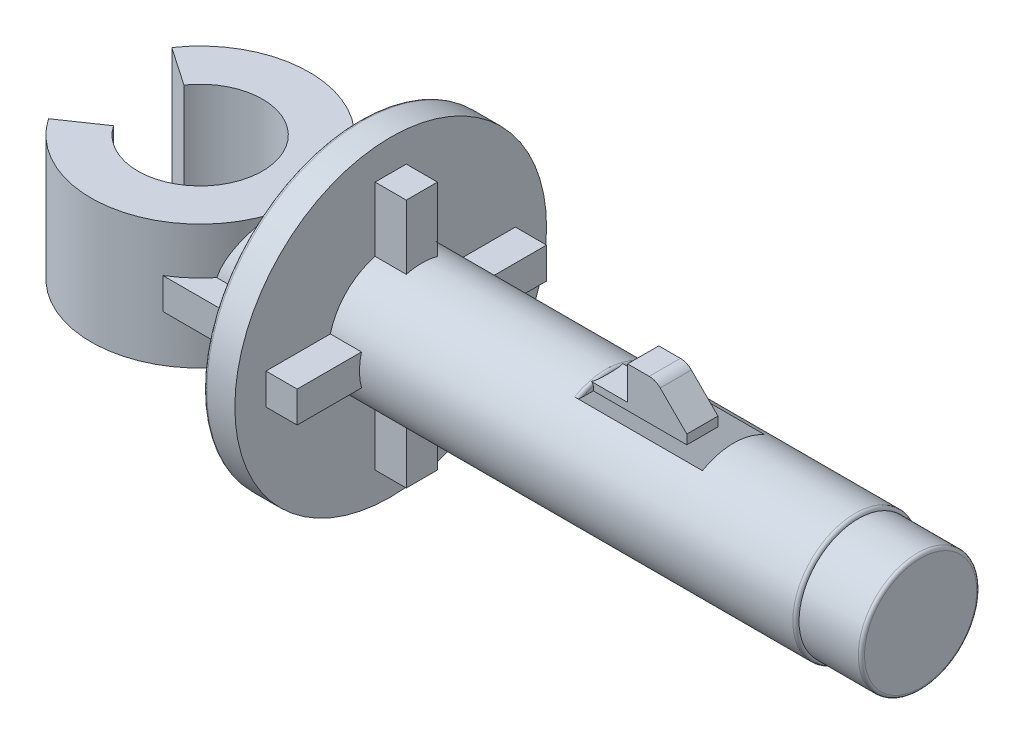
from build123d import *

# Parameters (mm, degrees)
SCHIZZO1_R                    = 2
ESTRUSIONE_ESTRUSIONE1_DEPTH  = 17
SCHIZZO2_OUTSIDE_W            = 9.584
SCHIZZO2_OUTSIDE_H            = 9.584
SCHIZZO2_OUTSIDE_R            = 1.9
TAGLIO_ESTRUSIONE1_DEPTH      = 2
SCHIZZO6_W                    = 15
SCHIZZO6_H                    = 4
TAGLIO_ESTRUSIONE3_DEPTH      = 0.1
TAGLIO_ESTRUSIONE4_DEPTH      = 1.7
TAGLIO_ESTRUSIONE4_DEPTH_BACK = 18.23368794
SCHIZZO5_W                    = 13
SCHIZZO5_H                    = 2
SCHIZZO7_W                    = 4
SCHIZZO7_H                    = 2
TAGLIO_ESTRUSIONE5_DEPTH      = 18.555910686
ESTRUSIONE_ESTRUSIONE2_DEPTH  = 0.5
TAGLIO_ESTRUSIONE6_DEPTH      = 0.07
ESTRUSIONE_ESTRUSIONE4_DEPTH  = 0.5
ESTRUSIONE_ESTRUSIONE5_DEPTH  = 0.5
SCHIZZO20_R                   = 5
ESTRUSIONE_ESTRUSIONE6_DEPTH  = 1
SCHIZZO23_R                   = 2.25
ESTRUSIONE_ESTRUSIONE7_DEPTH  = 3
ESTRUSIONE_ESTRUSIONE10_DEPTH = 2
ESTRUSIONE_ESTRUSIONE8_DEPTH  = 0.5
SCHIZZO35_W                   = 3
SCHIZZO35_H                   = 2.061552812
TAGLIO_ESTRUSIONE7_DEPTH      = 1
RACCORDO22_R                  = 0.5
RACCORDO23_R                  = 0.1
RACCORDO24_R                  = 0.1
RACCORDO25_R                  = 0.1
RACCORDO28_R                  = 0.1


# Some blends are built 0.0001 mm under size
with BuildPart() as part:
    # Schizzo1 → Estrusione-Estrusione1 (new body)
    with BuildSketch(Plane(origin=(0, 0, 0), x_dir=(0, 0, -1), z_dir=(1, 0, 0))):
        Circle(SCHIZZO1_R)
    extrude(amount=-ESTRUSIONE_ESTRUSIONE1_DEPTH)

    # Schizzo2 outside → Taglio-Estrusione1 (cut)
    with BuildSketch(Plane(origin=(0, 0, 0), x_dir=(0, 0, -1), z_dir=(1, 0, 0))):
        Rectangle(SCHIZZO2_OUTSIDE_W, SCHIZZO2_OUTSIDE_H)
        Circle(SCHIZZO2_OUTSIDE_R, mode=Mode.SUBTRACT)
    extrude(amount=-TAGLIO_ESTRUSIONE1_DEPTH, mode=Mode.SUBTRACT)

    # Schizzo6 → Taglio-Estrusione3 (cut)
    with BuildSketch(Plane(origin=(0, -2, 0), x_dir=(-1, 0, 0), z_dir=(0, -1, 0))):
        with Locations((9.5, 0)):
            Rectangle(SCHIZZO6_W, SCHIZZO6_H)
    extrude(amount=-TAGLIO_ESTRUSIONE3_DEPTH, mode=Mode.SUBTRACT)

    # Schizzo5 → Taglio-Estrusione4 (cut, two sides: drawn at the far end of the back side and taken through both)
    with BuildSketch(Plane(origin=(0, 0, 0), x_dir=(1, 0, 0), z_dir=(0, 1, 0)).offset(-TAGLIO_ESTRUSIONE4_DEPTH_BACK)):
        with Locations((-9.5, 0)):
            Rectangle(SCHIZZO5_W, SCHIZZO5_H)
    extrude(amount=TAGLIO_ESTRUSIONE4_DEPTH + TAGLIO_ESTRUSIONE4_DEPTH_BACK, mode=Mode.SUBTRACT)

    # Schizzo7 → Taglio-Estrusione5 (cut, through all)
    with BuildSketch(Plane(origin=(0, 2, 0), x_dir=(1, 0, 0), z_dir=(0, 1, 0))):
        with Locations((-8, 0)):
            Rectangle(SCHIZZO7_W, SCHIZZO7_H)
    extrude(amount=-TAGLIO_ESTRUSIONE5_DEPTH, mode=Mode.SUBTRACT)

    # Schizzo12 → Estrusione-Estrusione2 (add, symmetric)
    with BuildSketch(Plane.XY):
        Polygon((-10, 2), (-8.9, 2), (-8.9, 3), (-8, 3), (-7, 2), (-7, 1.7), (-10, 1.7), align=None)
    extrude(amount=ESTRUSIONE_ESTRUSIONE2_DEPTH, both=True)

    # Schizzo16 → Taglio-Estrusione6 (cut)
    with BuildSketch(Plane(origin=(0, 2, 0), x_dir=(1, 0, 0), z_dir=(0, 1, 0))):
        Polygon((-8.9, 0.5), (-10, 0.5), (-10, 0), (-10, -0.5), (-8.9, -0.5), align=None)
    extrude(amount=-TAGLIO_ESTRUSIONE6_DEPTH, mode=Mode.SUBTRACT)

    # Schizzo17 → Estrusione-Estrusione4 (add, symmetric)
    with BuildSketch(Plane.XY):
        Polygon((-17, 4), (-16, 4), (-16, 0.047058824), (-17, 0.05), align=None)
    estrusione_estrusione4 = extrude(amount=ESTRUSIONE_ESTRUSIONE4_DEPTH, both=True)

    # Specchia2: Estrusione-Estrusione4 across plane
    add(estrusione_estrusione4.mirror(Plane.ZX))

    # Schizzo19 → Estrusione-Estrusione5 (add, symmetric)
    with BuildSketch(Plane(origin=(0, 0, 0), x_dir=(1, 0, 0), z_dir=(0, 1, 0))):
        Polygon((-17, 2), (-17, 0), (-16, 0), (-16, 2), (-16, 4), (-17, 4), align=None)
    estrusione_estrusione5 = extrude(amount=ESTRUSIONE_ESTRUSIONE5_DEPTH, both=True)

    # Specchia5: Estrusione-Estrusione5 across plane
    add(estrusione_estrusione5.mirror(Plane.XY))

    # Schizzo20 → Estrusione-Estrusione6 (add)
    with BuildSketch(Plane.ZY.offset(17)):
        Circle(SCHIZZO20_R)
    extrude(amount=ESTRUSIONE_ESTRUSIONE6_DEPTH)

    # Schizzo23 → Estrusione-Estrusione7 (add)
    with BuildSketch(Plane.ZY.offset(18)):
        Circle(SCHIZZO23_R)
    extrude(amount=ESTRUSIONE_ESTRUSIONE7_DEPTH)

    # Schizzo22 → Estrusione-Estrusione10 (add, symmetric)
    with BuildSketch(Plane(origin=(0, 0, 0), x_dir=(1, 0, 0), z_dir=(0, 1, 0))):
        with BuildLine():
            Line((-24.762298216, -1.129872594), (-26, -1.977277039))
            ThreePointArc((-26, -1.977277039), (-19.612029171, 0), (-26, 1.977277039))
            Line((-26, 1.977277039), (-24.762298216, 1.129872594))
            ThreePointArc((-24.762298216, 1.129872594), (-21.112029171, 0), (-24.762298216, -1.129872594))
        make_face()
    extrude(amount=ESTRUSIONE_ESTRUSIONE10_DEPTH, both=True)

    # Schizzo34 → Estrusione-Estrusione8 (add, symmetric)
    with BuildSketch(Plane(origin=(0, 0, 0), x_dir=(1, 0, 0), z_dir=(0, 1, 0))):
        Polygon((-18, 3), (-21.309253533, 3), (-18, 0), align=None)
    estrusione_estrusione8 = extrude(amount=ESTRUSIONE_ESTRUSIONE8_DEPTH, both=True)

    # Specchia6: Estrusione-Estrusione8 across plane
    add(estrusione_estrusione8.mirror(Plane.XY))

    # Schizzo35 → Taglio-Estrusione7 (cut)
    with BuildSketch(Plane(origin=(0, 2, 0), x_dir=(1, 0, 0), z_dir=(0, 1, 0))):
        with Locations((-19.5, 0)):
            Rectangle(SCHIZZO35_W, SCHIZZO35_H)
    taglio_estrusione7 = extrude(amount=TAGLIO_ESTRUSIONE7_DEPTH, mode=Mode.SUBTRACT)

    # Specchia7: Taglio-Estrusione7 across plane
    add(taglio_estrusione7.mirror(Plane.ZX), mode=Mode.SUBTRACT)

    # Raccordo22
    raccordo22_edges = [part.edges().sort_by_distance(p)[0] for p in [
        (-8, 3, 0),
    ]]
    fillet(raccordo22_edges, radius=RACCORDO22_R)

    # Raccordo23
    raccordo23_edges = [part.edges().sort_by_distance(p)[0] for p in [
        (-2, 2, 0),
    ]]
    fillet(raccordo23_edges, radius=RACCORDO23_R - 0.0001)  # a hair under: the kernel refuses the full size

    # Raccordo24
    raccordo24_edges = [part.edges().sort_by_distance(p)[0] for p in [
        (0, 0, 1.9),
    ]]
    fillet(raccordo24_edges, radius=RACCORDO24_R)

    # Raccordo25
    raccordo25_edges = [part.edges().sort_by_distance(p)[0] for p in [
        (-18, 0, -5),
    ]]
    fillet(raccordo25_edges, radius=RACCORDO25_R)

    # Raccordo28
    # the kernel refuses this fillet: 0.1 mm, written as the material it takes off along each edge
    with BuildSketch(Plane(origin=(-10, 0, 0), x_dir=(0, 0.7969175395012055, 0.6040881022130338), z_dir=(0, -0.6040881022130338, 0.7969175395012055))) as raccordo28_piece_1_section:
        with BuildLine():
            CenterArc((2 - RACCORDO28_R, RACCORDO28_R), RACCORDO28_R, 270, 90)
            Line((2 - RACCORDO28_R, 0), (2, 0))
            Line((2, 0), (2, RACCORDO28_R))
        make_face()
    raccordo28_piece_1 = revolve(axis=Axis((-10, 0, 0), (-1, 0, 0)), revolution_arc=74.326501832, mode=Mode.PRIVATE)
    raccordo28_piece_1 = split(raccordo28_piece_1, bisect_by=Plane(origin=(-10.022414525, 1.819827674, 1), z_dir=(0, 0, -1)), keep=Keep.TOP, mode=Mode.PRIVATE)
    raccordo28_piece_1 = split(raccordo28_piece_1, bisect_by=Plane(origin=(-10.022414525, 1.819827674, 0.5), z_dir=(0, 0, 1)), keep=Keep.TOP, mode=Mode.PRIVATE)
    raccordo28_piece_1 = split(raccordo28_piece_1, bisect_by=Plane(origin=(-10.022414525, 1.93, 0.756995565), z_dir=(0, -1, 0)), keep=Keep.TOP, mode=Mode.PRIVATE)
    add(raccordo28_piece_1, mode=Mode.SUBTRACT)
    with BuildSketch(Plane(origin=(-10, 0, 0), x_dir=(0, 0.7969175395012055, 0.6040881022130338), z_dir=(0, -0.6040881022130338, 0.7969175395012055))) as raccordo28_piece_2_section:
        with BuildLine():
            CenterArc((2 - RACCORDO28_R, RACCORDO28_R), RACCORDO28_R, 270, 90)
            Line((2 - RACCORDO28_R, 0), (2, 0))
            Line((2, 0), (2, RACCORDO28_R))
        make_face()
    raccordo28_piece_2 = revolve(axis=Axis((-10, 0, 0), (-1, 0, 0)), revolution_arc=74.326501832, mode=Mode.PRIVATE)
    raccordo28_piece_2 = split(raccordo28_piece_2, bisect_by=Plane(origin=(-10.044225117, 1.932988234, 0.5), z_dir=(0, 0, 1)), keep=Keep.TOP, mode=Mode.PRIVATE)
    raccordo28_piece_2 = split(raccordo28_piece_2, bisect_by=Plane(origin=(-10.044225117, 1.93, 0.511192028), z_dir=(0, 1, 0)), keep=Keep.TOP, mode=Mode.PRIVATE)
    add(raccordo28_piece_2, mode=Mode.SUBTRACT)
    with BuildSketch(Plane(origin=(-10, 0, 0), x_dir=(0, 0.7969175395012055, 0.6040881022130338), z_dir=(0, -0.6040881022130338, 0.7969175395012055))) as raccordo28_piece_3_section:
        with BuildLine():
            CenterArc((2 - RACCORDO28_R, RACCORDO28_R), RACCORDO28_R, 270, 90)
            Line((2 - RACCORDO28_R, 0), (2, 0))
            Line((2, 0), (2, RACCORDO28_R))
        make_face()
    raccordo28_piece_3 = revolve(axis=Axis((-10, 0, 0), (-1, 0, 0)), revolution_arc=74.326501832, mode=Mode.PRIVATE)
    raccordo28_piece_3 = split(raccordo28_piece_3, bisect_by=Plane(origin=(-10.022414524, 1.819827674, -1), z_dir=(0, 0, 1)), keep=Keep.TOP, mode=Mode.PRIVATE)
    raccordo28_piece_3 = split(raccordo28_piece_3, bisect_by=Plane(origin=(-10.022414524, 1.93, -0.756995565), z_dir=(0, -1, 0)), keep=Keep.TOP, mode=Mode.PRIVATE)
    raccordo28_piece_3 = split(raccordo28_piece_3, bisect_by=Plane(origin=(-10.022414524, 1.819827674, -0.5), z_dir=(0, 0, -1)), keep=Keep.TOP, mode=Mode.PRIVATE)
    add(raccordo28_piece_3, mode=Mode.SUBTRACT)
    with BuildSketch(Plane(origin=(-10, 0, 0), x_dir=(0, 0.7969175395012055, 0.6040881022130338), z_dir=(0, -0.6040881022130338, 0.7969175395012055))) as raccordo28_piece_4_section:
        with BuildLine():
            CenterArc((2 - RACCORDO28_R, RACCORDO28_R), RACCORDO28_R, 270, 90)
            Line((2 - RACCORDO28_R, 0), (2, 0))
            Line((2, 0), (2, RACCORDO28_R))
        make_face()
    raccordo28_piece_4 = revolve(axis=Axis((-10, 0, 0), (-1, 0, 0)), revolution_arc=74.326501832, mode=Mode.PRIVATE)
    raccordo28_piece_4 = split(raccordo28_piece_4, bisect_by=Plane(origin=(-10.040080162, 1.981654904, 0.5), z_dir=(0, 0, -1)), keep=Keep.TOP, mode=Mode.PRIVATE)
    raccordo28_piece_4 = split(raccordo28_piece_4, bisect_by=Plane(origin=(-10.040080162, 1.93, 0), z_dir=(0, 1, 0)), keep=Keep.TOP, mode=Mode.PRIVATE)
    raccordo28_piece_4 = split(raccordo28_piece_4, bisect_by=Plane(origin=(-10.040080162, 1.981654904, -0.5), z_dir=(0, 0, 1)), keep=Keep.TOP, mode=Mode.PRIVATE)
    add(raccordo28_piece_4, mode=Mode.SUBTRACT)
    with BuildSketch(Plane(origin=(-10, 0, 0), x_dir=(0, 0.7969175395012055, 0.6040881022130338), z_dir=(0, -0.6040881022130338, 0.7969175395012055))) as raccordo28_piece_5_section:
        with BuildLine():
            CenterArc((2 - RACCORDO28_R, RACCORDO28_R), RACCORDO28_R, 270, 90)
            Line((2 - RACCORDO28_R, 0), (2, 0))
            Line((2, 0), (2, RACCORDO28_R))
        make_face()
    raccordo28_piece_5 = revolve(axis=Axis((-10, 0, 0), (-1, 0, 0)), revolution_arc=74.326501832, mode=Mode.PRIVATE)
    raccordo28_piece_5 = split(raccordo28_piece_5, bisect_by=Plane(origin=(-10.044225117, 1.93, -0.511192028), z_dir=(0, 1, 0)), keep=Keep.TOP, mode=Mode.PRIVATE)
    raccordo28_piece_5 = split(raccordo28_piece_5, bisect_by=Plane(origin=(-10.044225117, 1.932988234, -0.5), z_dir=(0, 0, -1)), keep=Keep.TOP, mode=Mode.PRIVATE)
    add(raccordo28_piece_5, mode=Mode.SUBTRACT)

    # Estrusione-Estrusione9 cone 1 section (through the dimple's axis) → Estrusione-Estrusione9 (revolve)
    with BuildSketch(Plane(origin=(-18, 0, 0), x_dir=(0, 0, -1), z_dir=(0, 1, 0))):
        Polygon((0, 0), (4.9, 0), (0, 0.864002205), align=None)
    revolve(axis=Axis((-18, 0, 0), (-1, 0, 0)))


solid = part.part
